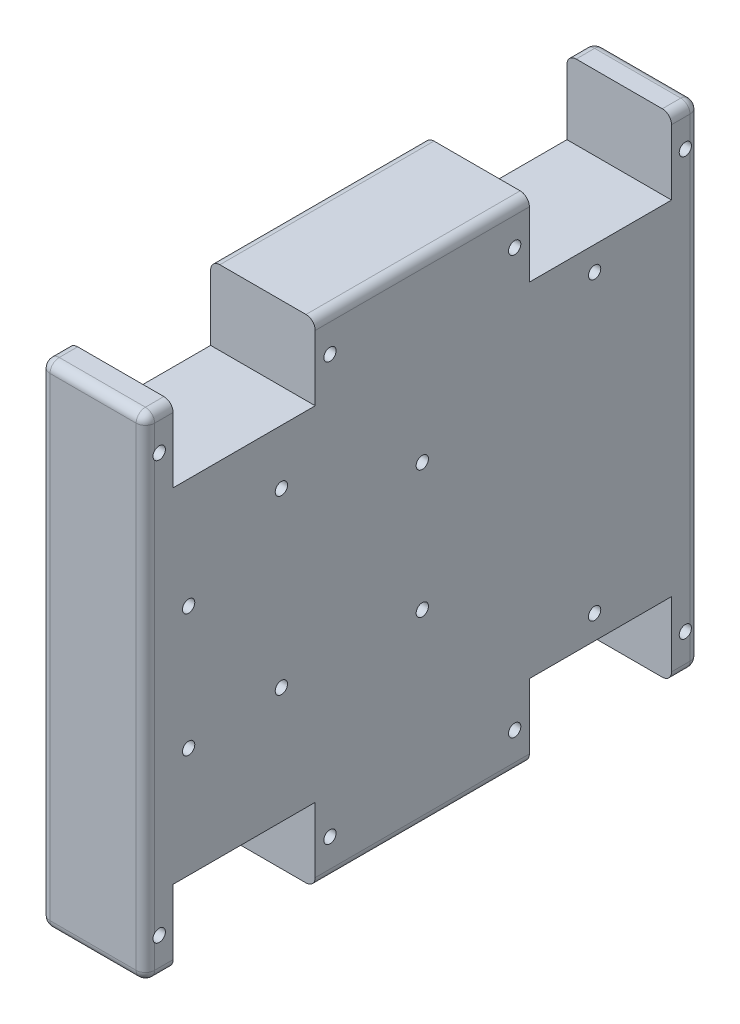
from build123d import *

# Parameters (mm, degrees)
SKETCH_1_R      = 1
EXTRUDE_1_DEPTH = 17
FILLET_1_R      = 1.5


with BuildPart() as part:
    # Эскиз1 → Бобышка-Вытянуть1 (new body)
    with BuildSketch(Plane(origin=(0, 0, 0), x_dir=(0, 0, -1), z_dir=(1, 0, 0))):
        Polygon((0, 40), (-17.4, 40), (-17.4, 27.9), (-40.5, 27.9), (-40.5, 40), (-45, 40), (-45, -40), (-40.5, -40), (-40.5, -27.9), (-17.4, -27.9), (-17.4, -40), (17.4, -40), (17.4, -27.9), (40.5, -27.9), (40.5, -40), (45, -40), (45, 40), (40.5, 40), (40.5, 27.9), (17.4, 27.9), (17.4, 40), align=None)
        with Locations((-42.75, -33.95)):
            Circle(SKETCH_1_R, mode=Mode.SUBTRACT)
        with Locations(Location((-15.009561353, -33.95, 0), (0, 0, 180))):
            Circle(SKETCH_1_R, mode=Mode.SUBTRACT)
        with Locations((15.009561353, -33.95)):
            Circle(SKETCH_1_R, mode=Mode.SUBTRACT)
        with Locations(Location((42.75, -33.95, 0), (0, 0, 180))):
            Circle(SKETCH_1_R, mode=Mode.SUBTRACT)
        with Locations((42.75, 33.95)):
            Circle(SKETCH_1_R, mode=Mode.SUBTRACT)
        with Locations(Location((15.009561353, 33.95, 0), (0, 0, 180))):
            Circle(SKETCH_1_R, mode=Mode.SUBTRACT)
        with Locations((-15.009561353, 33.95)):
            Circle(SKETCH_1_R, mode=Mode.SUBTRACT)
        with Locations(Location((-42.75, 33.95, 0), (0, 0, 180))):
            Circle(SKETCH_1_R, mode=Mode.SUBTRACT)
        with Locations((28, 24)):
            Circle(SKETCH_1_R, mode=Mode.SUBTRACT)
        with Locations((28, -24)):
            Circle(SKETCH_1_R, mode=Mode.SUBTRACT)
        with Locations((-22.9, -9)):
            Circle(SKETCH_1_R, mode=Mode.SUBTRACT)
        with Locations((-22.9, 19)):
            Circle(SKETCH_1_R, mode=Mode.SUBTRACT)
        with Locations((-37.974473267, -10)):
            Circle(SKETCH_1_R, mode=Mode.SUBTRACT)
        with Locations(Location((-37.974473267, 10, 0), (0, 0, 180))):
            Circle(SKETCH_1_R, mode=Mode.SUBTRACT)
        with Locations((0, 11.240266093)):
            Circle(SKETCH_1_R, mode=Mode.SUBTRACT)
        with Locations((0, -9.5)):
            Circle(SKETCH_1_R, mode=Mode.SUBTRACT)
    extrude(amount=EXTRUDE_1_DEPTH)

    # Скругление1
    # the kernel refuses this fillet: 1.5 mm, written as the material it takes off along each edge
    with BuildSketch(Plane(origin=(1.5, 38.5, -43.5), x_dir=(0, 0, -1), z_dir=(0, 1, 0))) as fillet_1_piece_1_section:
        Polygon((0, 0), (FILLET_1_R, 0), (FILLET_1_R, FILLET_1_R), (0, FILLET_1_R), align=None)
    fillet_1_piece_1 = extrude(amount=FILLET_1_R, mode=Mode.PRIVATE)
    fillet_1_piece_1 = fillet_1_piece_1 - Plane(origin=(1.5, 38.5, -43.5), x_dir=(0.7071067811865475, 0, 0.7071067811865475), z_dir=(0, 1, 0)) * Sphere(FILLET_1_R, mode=Mode.PRIVATE)
    add(fillet_1_piece_1, mode=Mode.SUBTRACT)
    with BuildSketch(Plane(origin=(1.5, -38.5, -43.5), x_dir=(0, 0, -1), z_dir=(-1, 0, 0))) as fillet_1_piece_2_section:
        Polygon((0, 0), (FILLET_1_R, 0), (FILLET_1_R, FILLET_1_R), (0, FILLET_1_R), align=None)
    fillet_1_piece_2 = extrude(amount=FILLET_1_R, mode=Mode.PRIVATE)
    fillet_1_piece_2 = fillet_1_piece_2 - Plane(origin=(1.5, -38.5, -43.5), x_dir=(0, 0.707106781186548, 0.707106781186547), z_dir=(-1, 0, 0)) * Sphere(FILLET_1_R, mode=Mode.PRIVATE)
    add(fillet_1_piece_2, mode=Mode.SUBTRACT)
    with BuildSketch(Plane(origin=(15.5, 38.5, 43.5), x_dir=(1, 0, 0), z_dir=(0, 1, 0))) as fillet_1_piece_3_section:
        Polygon((0, 0), (FILLET_1_R, 0), (FILLET_1_R, -FILLET_1_R), (0, -FILLET_1_R), align=None)
    fillet_1_piece_3 = extrude(amount=FILLET_1_R, mode=Mode.PRIVATE)
    fillet_1_piece_3 = fillet_1_piece_3 - Plane(origin=(15.5, 38.5, 43.5), x_dir=(-0.7071067811865475, 0, -0.7071067811865475), z_dir=(0, 1, 0)) * Sphere(FILLET_1_R, mode=Mode.PRIVATE)
    add(fillet_1_piece_3, mode=Mode.SUBTRACT)
    with BuildSketch(Plane(origin=(1.5, -38.5, 43.5), x_dir=(0, -1, 0), z_dir=(-1, 0, 0))) as fillet_1_piece_4_section:
        Polygon((0, 0), (FILLET_1_R, 0), (FILLET_1_R, FILLET_1_R), (0, FILLET_1_R), align=None)
    fillet_1_piece_4 = extrude(amount=FILLET_1_R, mode=Mode.PRIVATE)
    fillet_1_piece_4 = fillet_1_piece_4 - Plane(origin=(1.5, -38.5, 43.5), x_dir=(0, 0.7071067811865486, -0.7071067811865464), z_dir=(-1, 0, 0)) * Sphere(FILLET_1_R, mode=Mode.PRIVATE)
    add(fillet_1_piece_4, mode=Mode.SUBTRACT)
    with BuildSketch(Plane(origin=(1.5, 38.5, 43.5), x_dir=(-1, 0, 0), z_dir=(0, 1, 0))) as fillet_1_piece_5_section:
        Polygon((0, 0), (FILLET_1_R, 0), (FILLET_1_R, FILLET_1_R), (0, FILLET_1_R), align=None)
    fillet_1_piece_5 = extrude(amount=FILLET_1_R, mode=Mode.PRIVATE)
    fillet_1_piece_5 = fillet_1_piece_5 - Plane(origin=(1.5, 38.5, 43.5), x_dir=(0.7071067811865475, 0, -0.7071067811865475), z_dir=(0, 1, 0)) * Sphere(FILLET_1_R, mode=Mode.PRIVATE)
    add(fillet_1_piece_5, mode=Mode.SUBTRACT)
    with BuildSketch(Plane(origin=(15.5, -38.5, 43.5), x_dir=(0, -1, 0), z_dir=(1, 0, 0))) as fillet_1_piece_6_section:
        Polygon((0, 0), (FILLET_1_R, 0), (FILLET_1_R, -FILLET_1_R), (0, -FILLET_1_R), align=None)
    fillet_1_piece_6 = extrude(amount=FILLET_1_R, mode=Mode.PRIVATE)
    fillet_1_piece_6 = fillet_1_piece_6 - Plane(origin=(15.5, -38.5, 43.5), x_dir=(0, 0.7071067811865486, -0.7071067811865464), z_dir=(1, 0, 0)) * Sphere(FILLET_1_R, mode=Mode.PRIVATE)
    add(fillet_1_piece_6, mode=Mode.SUBTRACT)
    with BuildSketch(Plane(origin=(15.5, 38.5, -43.5), x_dir=(0, 1, 0), z_dir=(1, 0, 0))) as fillet_1_piece_7_section:
        Polygon((0, 0), (FILLET_1_R, 0), (FILLET_1_R, -FILLET_1_R), (0, -FILLET_1_R), align=None)
    fillet_1_piece_7 = extrude(amount=FILLET_1_R, mode=Mode.PRIVATE)
    fillet_1_piece_7 = fillet_1_piece_7 - Plane(origin=(15.5, 38.5, -43.5), x_dir=(0, -0.707106781186548, 0.7071067811865469), z_dir=(1, 0, 0)) * Sphere(FILLET_1_R, mode=Mode.PRIVATE)
    add(fillet_1_piece_7, mode=Mode.SUBTRACT)
    with BuildSketch(Plane(origin=(15.5, -38.5, -43.5), x_dir=(0, 0, -1), z_dir=(1, 0, 0))) as fillet_1_piece_8_section:
        Polygon((0, 0), (FILLET_1_R, 0), (FILLET_1_R, -FILLET_1_R), (0, -FILLET_1_R), align=None)
    fillet_1_piece_8 = extrude(amount=FILLET_1_R, mode=Mode.PRIVATE)
    fillet_1_piece_8 = fillet_1_piece_8 - Plane(origin=(15.5, -38.5, -43.5), x_dir=(0, 0.707106781186548, 0.707106781186547), z_dir=(1, 0, 0)) * Sphere(FILLET_1_R, mode=Mode.PRIVATE)
    add(fillet_1_piece_8, mode=Mode.SUBTRACT)
    with BuildSketch(Plane(origin=(0, 40, -43.5), x_dir=(1, 0, 0), z_dir=(0, 0, 1)), Plane(origin=(0, -40, -36.75), x_dir=(1, 0, 0), z_dir=(0, 0, -1)), Plane(origin=(17, 40, 36.75), x_dir=(0, -1, 0), z_dir=(0, 0, 1)), Plane(origin=(0, -40, 43.5), x_dir=(1, 0, 0), z_dir=(0, 0, -1)), Plane(origin=(0, 40, 36.75), x_dir=(1, 0, 0), z_dir=(0, 0, 1)), Plane(origin=(17, -40, 43.5), x_dir=(0, 1, 0), z_dir=(0, 0, -1)), Plane(origin=(17, -40, -36.75), x_dir=(0, 1, 0), z_dir=(0, 0, -1)), Plane(origin=(17, 40, -43.5), x_dir=(0, -1, 0), z_dir=(0, 0, 1))) as fillet_1_piece_9:
        with BuildLine():
            CenterArc((FILLET_1_R, -FILLET_1_R), FILLET_1_R, 90, 90)
            Line((0, -FILLET_1_R), (0, 0))
            Line((0, 0), (FILLET_1_R, 0))
        make_face()
    extrude(amount=6.75, mode=Mode.SUBTRACT)
    with BuildSketch(Plane(origin=(0, -38.5, -45), x_dir=(1, 0, 0), z_dir=(0, 1, 0)), Plane(origin=(0, 38.5, 45), x_dir=(1, 0, 0), z_dir=(0, -1, 0)), Plane(origin=(17, 38.5, 45), x_dir=(0, 0, -1), z_dir=(0, -1, 0)), Plane(origin=(17, -38.5, -45), x_dir=(0, 0, 1), z_dir=(0, 1, 0))) as fillet_1_piece_10:
        with BuildLine():
            CenterArc((FILLET_1_R, -FILLET_1_R), FILLET_1_R, 90, 90)
            Line((0, -FILLET_1_R), (0, 0))
            Line((0, 0), (FILLET_1_R, 0))
        make_face()
    extrude(amount=77, mode=Mode.SUBTRACT)
    with BuildSketch(Plane(origin=(0, -40, 21.15), x_dir=(1, 0, 0), z_dir=(0, 0, -1)), Plane(origin=(0, 40, -21.15), x_dir=(1, 0, 0), z_dir=(0, 0, 1)), Plane(origin=(17, -40, 21.15), x_dir=(0, 1, 0), z_dir=(0, 0, -1)), Plane(origin=(17, 40, 21.15), x_dir=(-1, 0, 0), z_dir=(0, 0, -1))) as fillet_1_piece_11:
        with BuildLine():
            CenterArc((FILLET_1_R, -FILLET_1_R), FILLET_1_R, 90, 90)
            Line((0, -FILLET_1_R), (0, 0))
            Line((0, 0), (FILLET_1_R, 0))
        make_face()
    extrude(amount=42.3, mode=Mode.SUBTRACT)
    with BuildSketch(Plane(origin=(1.5, 40, -45), x_dir=(0, 0, 1), z_dir=(1, 0, 0)), Plane(origin=(1.5, -40, -45), x_dir=(0, 1, 0), z_dir=(1, 0, 0)), Plane(origin=(1.5, -40, 45), x_dir=(0, 0, -1), z_dir=(1, 0, 0)), Plane(origin=(1.5, 40, 45), x_dir=(0, -1, 0), z_dir=(1, 0, 0))) as fillet_1_piece_12:
        with BuildLine():
            CenterArc((FILLET_1_R, FILLET_1_R), FILLET_1_R, 180, 90)
            Line((0, FILLET_1_R), (0, 0))
            Line((0, 0), (FILLET_1_R, 0))
        make_face()
    extrude(amount=14, mode=Mode.SUBTRACT)


solid = part.part
